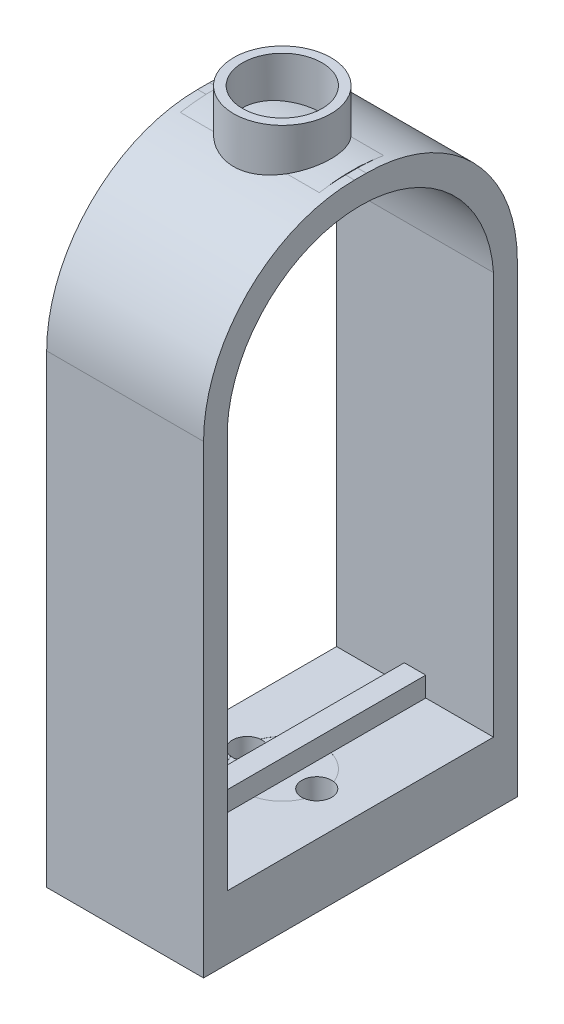
from build123d import *

# Parameters (mm, degrees)
MAINBASESKETCH_W                 = 7.9
MAINBASESKETCH_H                 = 3.2
MAINBASEEXTRUDE_DEPTH            = 7.9
MAINBASESHELL_T                  = -1.2
SLIMYELLOWUNDEREXT_START         = -0.2
SLIMYELLOWUNDEREXT_DEPTH         = 1
SLIMYELLLOWUPPERCIRCLESKETCH_R   = 2.45
SLIMYELLLOWUPPERCIRCLESKETCH_R_2 = 2
SLIMYELLOWUPPERCIRCLE_DEPTH      = 2
MOVE_START                       = 3.2
MOVE_FACE2_OUTLINE_W             = 7.9
MOVE_FACE2_OUTLINE_H             = 15.8
MOVE_FACE2_OUTLINE_R             = 2
MOVE_FACE2_DEPTH                 = 27.8
MOVE_START_2                     = 31
MOVE_FACE2_2_OUTLINE_R           = 2.45
MOVE_FACE2_2_OUTLINE_R_2         = 2
MOVE_FACE2_2_DEPTH               = 2
FILLET25_R                       = 7.6
FILLET26_R                       = 7.6
CUT_EXTRUDE55_DEPTH              = 35.839919773
CUT_EXTRUDE57_REACH              = 35.122
SKETCH160_R                      = 0.75
BOSS_EXTRUDE20_DEPTH             = 3.5
SKETCH162_W                      = 1.07792119
SKETCH162_H                      = 13.4
BOSS_EXTRUDE21_DEPTH             = 1


# Read off the part's stored shape, not the designer's step: Move Face2
with BuildPart() as part:
    # MainBaseSketch → MainBaseExtrude (new, symmetric)
    with BuildSketch(Plane.XY):
        with Locations((4.631967213, 1.6)):
            Rectangle(MAINBASESKETCH_W, MAINBASESKETCH_H)
    extrude(amount=MAINBASEEXTRUDE_DEPTH, both=True)

    # MainBaseShell
    mainbaseshell_openings = [part.faces().sort_by_distance(p)[0] for p in [
        (4.631967213, 0, 0),
    ]]
    offset(amount=MAINBASESHELL_T, openings=mainbaseshell_openings, kind=Kind.INTERSECTION)

    # SlimYellowUnderExtSketch → SlimYellowUnderExt (add)
    with BuildSketch(Plane.XZ.offset(-2).offset(SLIMYELLOWUNDEREXT_START)):
        Polygon((1.881967213, 1.952811318), (1.881967213, 2.947188682), (2.384104441, 2.947188682), (2.882626102, 2.45), (2.384104441, 1.952811318), align=None)
        Polygon((6.381308324, 2.45), (6.879829986, 2.947188682), (7.381967213, 2.947188682), (7.381967213, 1.952811318), (6.879829986, 1.952811318), align=None)
        Polygon((1.881967213, -1.952811318), (2.384104441, -1.952811318), (2.882626102, -2.45), (2.384104441, -2.947188682), (1.881967213, -2.947188682), align=None)
        Polygon((7.381967213, -1.952811318), (7.381967213, -2.947188682), (6.879829986, -2.947188682), (6.381308324, -2.45), (6.879829986, -1.952811318), align=None)
    extrude(amount=SLIMYELLOWUNDEREXT_DEPTH)

    # SlimYelllowUpperCircleSketch → SlimYellowUpperCircle (add)
    with BuildSketch(Plane(origin=(0, 3.2, 0), x_dir=(1, 0, 0), z_dir=(0, 1, 0))):
        with Locations((4.647335619, 0)):
            Circle(SLIMYELLLOWUPPERCIRCLESKETCH_R)
        with Locations(Location((4.647335619, 0, 0), (0, 0, 270))):
            Circle(SLIMYELLLOWUPPERCIRCLESKETCH_R_2, mode=Mode.SUBTRACT)
    extrude(amount=SLIMYELLOWUPPERCIRCLE_DEPTH)

    # Move Face2 outline → Move Face2 (add)
    with BuildSketch(Plane(origin=(0, 0, 0), x_dir=(1, 0, 0), z_dir=(0, 1, 0)).offset(MOVE_START)):
        with Locations((4.631967213, 0)):
            Rectangle(MOVE_FACE2_OUTLINE_W, MOVE_FACE2_OUTLINE_H)
        with Locations((4.647335619, 0)):
            Circle(MOVE_FACE2_OUTLINE_R, mode=Mode.SUBTRACT)
    extrude(amount=MOVE_FACE2_DEPTH)

    # Move Face2 2 outline → Move Face2 2 (add)
    with BuildSketch(Plane(origin=(0, 0, 0), x_dir=(1, 0, 0), z_dir=(0, 1, 0)).offset(MOVE_START_2)):
        with Locations((4.647335619, 0)):
            Circle(MOVE_FACE2_2_OUTLINE_R)
        with Locations((4.647335619, 0)):
            Circle(MOVE_FACE2_2_OUTLINE_R_2, mode=Mode.SUBTRACT)
    extrude(amount=MOVE_FACE2_2_DEPTH)

    # Fillet25
    # the kernel refuses this fillet: 7.6 mm, written as the material it takes off along each edge
    with BuildSketch(Plane(origin=(0.681967213, 31, 7.9), x_dir=(0, 0, -1), z_dir=(1, 0, 0))) as fillet25_piece_1_section:
        with BuildLine():
            CenterArc((FILLET25_R, -FILLET25_R), FILLET25_R, 90, 90)
            Line((0, -FILLET25_R), (-FILLET25_R * 0.02, -FILLET25_R))
            Line((-FILLET25_R * 0.02, -FILLET25_R), (-FILLET25_R * 0.02, FILLET25_R * 0.02))
            Line((-FILLET25_R * 0.02, FILLET25_R * 0.02), (FILLET25_R, FILLET25_R * 0.02))
            Line((FILLET25_R, FILLET25_R * 0.02), (FILLET25_R, 0))
        make_face()
    fillet25_piece_1 = extrude(amount=7.9, mode=Mode.PRIVATE)
    fillet25_piece_1 = fillet25_piece_1 - Plane(origin=(4.647335619, 29.251763141, 0), x_dir=(1, 0, 0), z_dir=(0, -1, 0)) * Cylinder(2.45, 47, mode=Mode.PRIVATE)
    add(fillet25_piece_1, mode=Mode.SUBTRACT)

    # Fillet26
    # the kernel refuses this fillet: 7.6 mm, written as the material it takes off along each edge
    with BuildSketch(Plane(origin=(27.581967213, 31, -7.9), x_dir=(0, 0, 1), z_dir=(-1, 0, 0))) as fillet26_piece_1_section:
        with BuildLine():
            CenterArc((FILLET26_R, -FILLET26_R), FILLET26_R, 90, 90)
            Line((0, -FILLET26_R), (0, 0))
            Line((0, 0), (FILLET26_R, 0))
        make_face()
    fillet26_piece_1 = extrude(amount=45.9, mode=Mode.PRIVATE)
    fillet26_piece_1 = fillet26_piece_1 - Plane(origin=(4.647335619, 29.29236393, 0), x_dir=(1, 0, 0), z_dir=(0, -1, 0)) * Cylinder(2.45, 123, mode=Mode.PRIVATE)
    add(fillet26_piece_1, mode=Mode.SUBTRACT)

    # Sketch159 → Cut-Extrude55 (cut, through all)
    with BuildSketch(Plane(origin=(8.581967213, 0, 0), x_dir=(0, 0, -1), z_dir=(1, 0, 0))):
        with BuildLine():
            Line((6.7, 3.204620212), (6.7, 23.463811934))
            ThreePointArc((6.7, 23.463811934), (0, 29.737650856), (-6.7, 23.463811934))
            Line((-6.7, 23.463811934), (-6.7, 3.204620212))
            Line((-6.7, 3.204620212), (6.7, 3.204620212))
        make_face()
    extrude(amount=-CUT_EXTRUDE55_DEPTH, mode=Mode.SUBTRACT)

    # Sketch160 → Cut-Extrude57 (cut, up to next)
    with BuildSketch(Plane(origin=(0, 2, 0), x_dir=(-1, 0, 0), z_dir=(0, -1, 0)), mode=Mode.PRIVATE) as cut_extrude57_sk1:
        with Locations(Location((-6.381967213, 0, 0), (0, 0, 180))):
            Circle(SKETCH160_R)
    cut_extrude57_tool1 = extrude(cut_extrude57_sk1.sketch, amount=-CUT_EXTRUDE57_REACH, mode=Mode.PRIVATE) & part.part
    # Sketch160 → Cut-Extrude57 (cut, up to next)
    with BuildSketch(Plane(origin=(0, 2, 0), x_dir=(-1, 0, 0), z_dir=(0, -1, 0)), mode=Mode.PRIVATE) as cut_extrude57_sk2:
        with Locations(Location((-2.881967213, 0, 0), (0, 0, 180))):
            Circle(SKETCH160_R)
    cut_extrude57_tool2 = extrude(cut_extrude57_sk2.sketch, amount=-CUT_EXTRUDE57_REACH, mode=Mode.PRIVATE) & part.part
    add(cut_extrude57_tool1.solids().sort_by_distance((6.381967, 2, 0))[0], mode=Mode.SUBTRACT)
    add(cut_extrude57_tool2.solids().sort_by_distance((2.881967, 2, 0))[0], mode=Mode.SUBTRACT)

    # Sketch161 → Boss-Extrude20 (add, symmetric)
    with BuildSketch(Plane(origin=(4.631967213, 0, 0), x_dir=(0, 0, -1), z_dir=(1, 0, 0))):
        with BuildLine():
            Line((2.455062292, 30.688052313), (2.455062292, 30.469179439))
            Line((2.455062292, 30.469179439), (2.455062292, 29.272723248))
            ThreePointArc((2.455062292, 29.272723248), (0, 29.737650856), (-2.455062292, 29.272723248))
            Line((-2.455062292, 29.272723248), (-2.455062292, 30.526922148))
            Line((-2.455062292, 30.526922148), (-2.455062292, 30.688052313))
            ThreePointArc((-2.455062292, 30.688052313), (0, 31.033009473), (2.455062292, 30.688052313))
        make_face()
    extrude(amount=BOSS_EXTRUDE20_DEPTH, both=True)

    # Sketch162 → Boss-Extrude21 (add)
    with BuildSketch(Plane(origin=(0, 3.204620212, 0), x_dir=(1, 0, 0), z_dir=(0, 1, 0))):
        with Locations((4.631967213, 0)):
            Rectangle(SKETCH162_W, SKETCH162_H)
    extrude(amount=BOSS_EXTRUDE21_DEPTH)


solid = part.part
